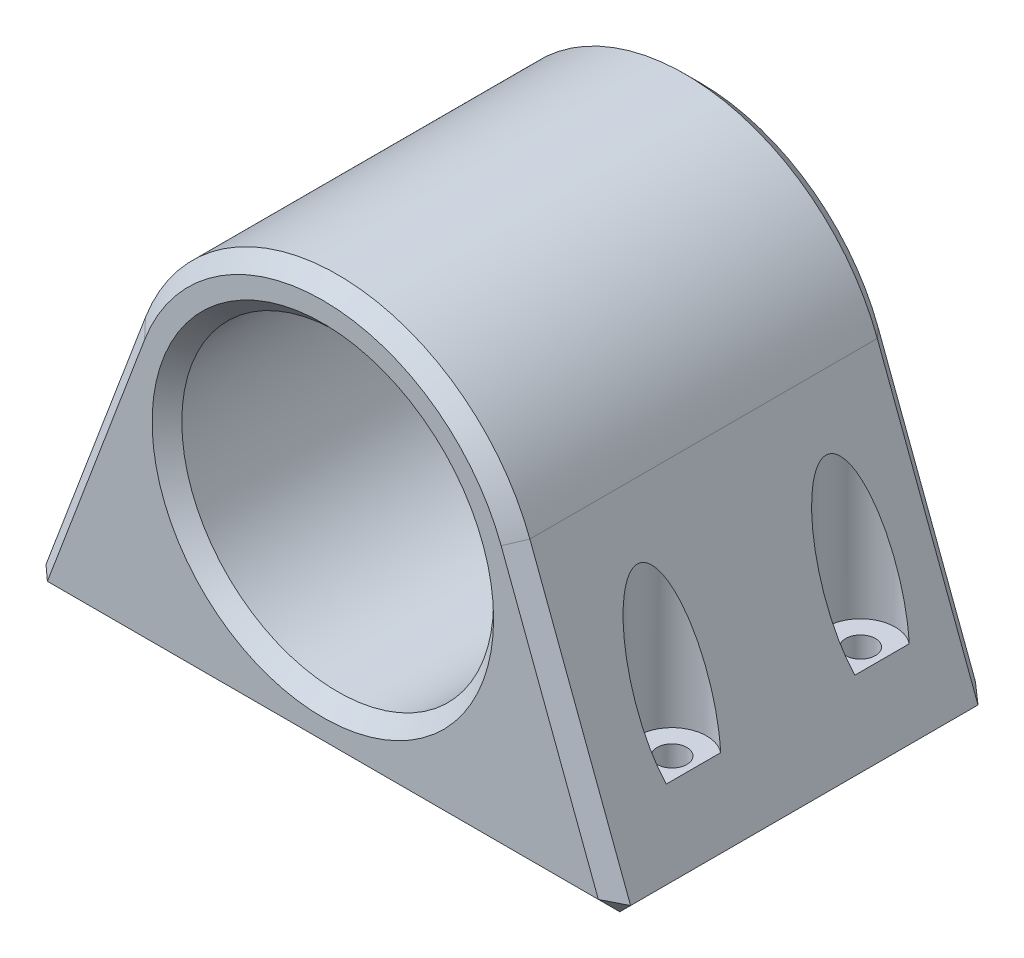
from build123d import *

# Parameters (mm, degrees)
SKETCH1_R           = 31.500002617
BOSS_EXTRUDE1_DEPTH = 76.2
SKETCH2_R           = 3
CUT_EXTRUDE1_DEPTH  = 335.545125332
SKETCH3_R           = 7
CUT_EXTRUDE2_DEPTH  = 332.142628978


with BuildPart() as part:
    # Sketch1 → Boss-Extrude1 (new body)
    with BuildSketch(Plane.XY):
        with BuildLine():
            Line((254.999981536, -0.500000028), (315.000000023, -0.500000028))
            Line((315.000000023, -0.500000028), (293.831301967, 55.641681824))
            ThreePointArc((293.831301967, 55.641681824), (254.99996624, 82.500005207), (216.168650312, 55.6416532))
            Line((216.168650312, 55.6416532), (195.000010316, -0.500000028))
            Line((195.000010316, -0.500000028), (254.999981536, -0.500000028))
        make_face()
        with Locations(Location((254.999981536, 41.00000259, 0), (0, 0, 180))):
            Circle(SKETCH1_R, mode=Mode.SUBTRACT)
    extrude(amount=BOSS_EXTRUDE1_DEPTH)

    # Sketch2 → Cut-Extrude1 (cut, through all)
    with BuildSketch(Plane.XZ.offset(0.500000028)):
        with Locations((205.000010316, 55.65)):
            Circle(SKETCH2_R)
        with Locations((205.000010316, 17.55)):
            Circle(SKETCH2_R)
        with Locations((305.000000023, 17.55)):
            Circle(SKETCH2_R)
        with Locations((305.000000023, 55.65)):
            Circle(SKETCH2_R)
    extrude(amount=-CUT_EXTRUDE1_DEPTH, mode=Mode.SUBTRACT)

    # Sketch3 → Cut-Extrude2 (cut, through all)
    with BuildSketch(Plane(origin=(0, 14.499999972, 0), x_dir=(-1, 0, 0), z_dir=(0, -1, 0))):
        with Locations((-205.000010316, -55.65)):
            Circle(SKETCH3_R)
        with Locations((-205.000010316, -17.55)):
            Circle(SKETCH3_R)
        with Locations((-305.000000023, -17.55)):
            Circle(SKETCH3_R)
        with Locations((-305.000000023, -55.65)):
            Circle(SKETCH3_R)
    extrude(amount=-CUT_EXTRUDE2_DEPTH, mode=Mode.SUBTRACT)

    # Chamfer1
    # the kernel refuses this chamfer: 3, 2.32827876, 2.328277984 mm, written as the material it takes off along each edge
    with BuildSketch(Plane(origin=(312.2804021, 1.226185537, 2), x_dir=(0.7489750456743214, -0.1749877092594348, 0.6390740822199596), z_dir=(0.49445065392204135, -0.49445065392203297, -0.7148685904920845))) as chamfer1_piece_1:
        Polygon((-2.712706316, -0.938589866), (1.981585134, -0.938589866), (0.731121181, 1.877179732), align=None)
    extrude(amount=3.990753507, mode=Mode.SUBTRACT)
    with BuildSketch(Plane(origin=(312.2804021, 1.226185537, 74.2), x_dir=(0.7489750456743212, -0.17498770925943466, -0.6390740822199599), z_dir=(0.49445065392204157, -0.4944506539220329, 0.7148685904920844))) as chamfer1_piece_2:
        Polygon((-2.712706316, 0.938589866), (1.981585134, 0.938589866), (0.731121181, -1.877179732), align=None)
    extrude(amount=3.990753507, mode=Mode.SUBTRACT)
    with BuildSketch(Plane(origin=(197.57469642, 1.435694642, 2), x_dir=(-0.7370953833685595, -0.043367244138400055, 0.6743957873182457), z_dir=(-0.6371026460751021, -0.2882074086415896, -0.7148683151239834))) as chamfer1_piece_3:
        Polygon((-2.694196805, 0.990466053), (1.754229559, 0.990466053), (0.939967246, -1.980932106), align=None)
    extrude(amount=3.990753255, mode=Mode.SUBTRACT)
    with BuildSketch(Plane(origin=(197.57469642, 1.435694642, 74.2), x_dir=(0.4121611112794653, -0.9111109802591978, 0), z_dir=(-0.637102646075102, -0.2882074086415896, 0.7148683151239834))) as chamfer1_piece_4:
        Polygon((-1.418873162, -1.430085067), (1.662073143, -1.430085067), (-0.243199981, 2.860170134), align=None)
    extrude(amount=3.990753255, mode=Mode.SUBTRACT)
    with BuildSketch(Plane(origin=(315.000000023, -0.500000028, -7.715048964), x_dir=(-0.9996219169112968, -0.027495876610586858, 0), z_dir=(0, 0, 1))) as chamfer1_piece_5:
        with BuildLine():
            Line((3.086019586, 0), (0.674077573, -2.282806951))
            Line((0.674077573, -2.282806951), (0.617375083, -2.302423975))
            ThreePointArc((0.617375083, -2.302423975), (0.331998575, -1.143147207), (-0.05670249, -0.019617024))
            Line((-0.05670249, -0.019617024), (0.001649753, 0.059977315))
            ThreePointArc((0.001649753, 0.059977315), (1.543492994, 0.017566949), (3.087669338, 0.059977315))
            Line((3.087669338, 0.059977315), (3.086019586, 0))
        make_face()
    extrude(amount=91.630097928, mode=Mode.SUBTRACT)
    with BuildSketch(Plane(origin=(195.000010316, -0.500000028, -7.715048964), x_dir=(0.9989444981358719, -0.04593353507048098, 0), z_dir=(0, 0, 1))) as chamfer1_piece_6:
        with BuildLine():
            Line((2.380250452, 0), (0.873946844, 2.959684746))
            Line((0.873946844, 2.959684746), (0.81689207, 2.978252267))
            ThreePointArc((0.81689207, 2.978252267), (0.420262466, 1.485280674), (-0.057054773, 0.018567521))
            Line((-0.057054773, 0.018567521), (0.002756012, -0.05993667))
            ThreePointArc((0.002756012, -0.05993667), (1.190370205, -0.005327712), (2.383006464, -0.05993667))
            Line((2.383006464, -0.05993667), (2.380250452, 0))
        make_face()
    extrude(amount=91.630097928, mode=Mode.SUBTRACT)
    with BuildSketch(Plane(origin=(317.721958218, -7.71892821, 76.2), x_dir=(-0.9353406389810182, -0.3526781334871724, 0.027495876610586882), z_dir=(-0.3528115255584857, 0.9356944092133361, 0))) as chamfer1_piece_7:
        with BuildLine():
            Line((3.086019586, 0), (-0.169641465, -3.081353381))
            Line((-0.169641465, -3.081353381), (-0.22961878, -3.079703628))
            ThreePointArc((-0.22961878, -3.079703628), (-0.102387681, -1.540193489), (-0.059977315, 0.001649753))
            Line((-0.059977315, 0.001649753), (0.001649753, 0.059977315))
            ThreePointArc((0.001649753, 0.059977315), (1.543492994, 0.017566949), (3.087669338, 0.059977315))
            Line((3.087669338, 0.059977315), (3.086019586, 0))
        make_face()
    extrude(amount=67.715067451, mode=Mode.SUBTRACT)
    with BuildSketch(Plane(origin=(254.999981536, 41.00000259, 76.2), x_dir=(0.9356944092133357, 0.3528115255584864, 0), z_dir=(0.3528115255584864, -0.9356944092133357, 0))) as chamfer1_piece_8:
        with BuildLine():
            Line((41.584855431, -3.084852814), (38.415149803, 0.084852814))
            Line((38.415149803, 0.084852814), (38.415149803, 0.144852814))
            ThreePointArc((38.415149803, 0.144852814), (39.95757621, 0.06), (41.500002617, 0.06))
            Line((41.500002617, 0.06), (41.560002617, 0))
            ThreePointArc((41.560002617, 0), (41.560002617, -1.542426407), (41.644855431, -3.084852814))
            Line((41.644855431, -3.084852814), (41.584855431, -3.084852814))
        make_face()
    revolve(axis=Axis((254.999981536, 41.00000259, 76.2), (0, 0, 1)), revolution_arc=138.681287603, mode=Mode.SUBTRACT)
    with BuildSketch(Plane(origin=(216.168650312, 55.6416532, 76.2), x_dir=(0.9353408989512485, -0.3526774440171723, 0.027495876610586775), z_dir=(-0.35281083582771006, -0.9356946692818939, 0))) as chamfer1_piece_9:
        with BuildLine():
            Line((3.086019586, 0), (-0.169641465, -3.081353381))
            Line((-0.169641465, -3.081353381), (-0.22961878, -3.079703628))
            ThreePointArc((-0.22961878, -3.079703628), (-0.102387681, -1.540193489), (-0.059977315, 0.001649753))
            Line((-0.059977315, 0.001649753), (0.001649753, 0.059977315))
            ThreePointArc((0.001649753, 0.059977315), (1.543492994, 0.017566949), (3.087669338, 0.059977315))
            Line((3.087669338, 0.059977315), (3.086019586, 0))
        make_face()
    extrude(amount=67.715020184, mode=Mode.SUBTRACT)
    with BuildSketch(Plane(origin=(305.000000023, -0.500000028, 55.65), x_dir=(1, 0, 0), z_dir=(0, 0, -1))) as chamfer1_piece_10:
        with BuildLine():
            Line((6.084852814, 0.084852814), (2.915147186, -3.084852814))
            Line((2.915147186, -3.084852814), (2.855147186, -3.084852814))
            ThreePointArc((2.855147186, -3.084852814), (2.94, -1.542426407), (2.94, 0))
            Line((2.94, 0), (3, 0.06))
            ThreePointArc((3, 0.06), (4.542426407, 0.06), (6.084852814, 0.144852814))
            Line((6.084852814, 0.144852814), (6.084852814, 0.084852814))
        make_face()
    revolve(axis=Axis((305.000000023, -0.500000028, 55.65), (0, -1, 0)), mode=Mode.SUBTRACT)
    with BuildSketch(Plane(origin=(305.000000023, -0.500000028, 17.55), x_dir=(1, 0, 0), z_dir=(0, 0, -1))) as chamfer1_piece_11:
        with BuildLine():
            Line((6.084852814, 0.084852814), (2.915147186, -3.084852814))
            Line((2.915147186, -3.084852814), (2.855147186, -3.084852814))
            ThreePointArc((2.855147186, -3.084852814), (2.94, -1.542426407), (2.94, 0))
            Line((2.94, 0), (3, 0.06))
            ThreePointArc((3, 0.06), (4.542426407, 0.06), (6.084852814, 0.144852814))
            Line((6.084852814, 0.144852814), (6.084852814, 0.084852814))
        make_face()
    revolve(axis=Axis((305.000000023, -0.500000028, 17.55), (0, -1, 0)), mode=Mode.SUBTRACT)
    with BuildSketch(Plane(origin=(322.715048987, -0.500000028, 76.2), x_dir=(0, 0.9996219169112968, 0.027495876610586778), z_dir=(-1, 0, 0))) as chamfer1_piece_12:
        with BuildLine():
            Line((3.086019586, 0), (-0.169641465, 3.081353381))
            Line((-0.169641465, 3.081353381), (-0.22961878, 3.079703628))
            ThreePointArc((-0.22961878, 3.079703628), (-0.102387681, 1.540193489), (-0.059977315, -0.001649753))
            Line((-0.059977315, -0.001649753), (0.001649753, -0.059977315))
            ThreePointArc((0.001649753, -0.059977315), (1.543492994, -0.017566949), (3.087669338, -0.059977315))
            Line((3.087669338, -0.059977315), (3.086019586, 0))
        make_face()
    extrude(amount=135.430087635, mode=Mode.SUBTRACT)
    with BuildSketch(Plane(origin=(205.000010316, -0.500000028, 17.55), x_dir=(1, 0, 0), z_dir=(0, 0, -1))) as chamfer1_piece_13:
        with BuildLine():
            Line((6.084852814, 0.084852814), (2.915147186, -3.084852814))
            Line((2.915147186, -3.084852814), (2.855147186, -3.084852814))
            ThreePointArc((2.855147186, -3.084852814), (2.94, -1.542426407), (2.94, 0))
            Line((2.94, 0), (3, 0.06))
            ThreePointArc((3, 0.06), (4.542426407, 0.06), (6.084852814, 0.144852814))
            Line((6.084852814, 0.144852814), (6.084852814, 0.084852814))
        make_face()
    revolve(axis=Axis((205.000010316, -0.500000028, 17.55), (0, -1, 0)), mode=Mode.SUBTRACT)
    with BuildSketch(Plane(origin=(205.000010316, -0.500000028, 55.65), x_dir=(1, 0, 0), z_dir=(0, 0, -1))) as chamfer1_piece_14:
        with BuildLine():
            Line((6.084852814, 0.084852814), (2.915147186, -3.084852814))
            Line((2.915147186, -3.084852814), (2.855147186, -3.084852814))
            ThreePointArc((2.855147186, -3.084852814), (2.94, -1.542426407), (2.94, 0))
            Line((2.94, 0), (3, 0.06))
            ThreePointArc((3, 0.06), (4.542426407, 0.06), (6.084852814, 0.144852814))
            Line((6.084852814, 0.144852814), (6.084852814, 0.084852814))
        make_face()
    revolve(axis=Axis((205.000010316, -0.500000028, 55.65), (0, -1, 0)), mode=Mode.SUBTRACT)
    with BuildSketch(Plane(origin=(254.999981536, 41.00000259, 76.2), x_dir=(-1, 0, 0), z_dir=(0, 1, 0))) as chamfer1_piece_15:
        with BuildLine():
            Line((34.584855431, 0.084852814), (31.415149803, -3.084852814))
            Line((31.415149803, -3.084852814), (31.355149803, -3.084852814))
            ThreePointArc((31.355149803, -3.084852814), (31.440002617, -1.542426407), (31.440002617, 0))
            Line((31.440002617, 0), (31.500002617, 0.06))
            ThreePointArc((31.500002617, 0.06), (33.042429024, 0.06), (34.584855431, 0.144852814))
            Line((34.584855431, 0.144852814), (34.584855431, 0.084852814))
        make_face()
    revolve(axis=Axis((254.999981536, 41.00000259, 76.2), (0, 0, 1)), mode=Mode.SUBTRACT)
    with BuildSketch(Plane(origin=(187.284961352, -0.500000028, 0), x_dir=(0, -0.027495876610586382, 0.9996219169112968), z_dir=(1, 0, 0))) as chamfer1_piece_16:
        with BuildLine():
            Line((3.086019586, 0), (-0.169641465, -3.081353381))
            Line((-0.169641465, -3.081353381), (-0.22961878, -3.079703628))
            ThreePointArc((-0.22961878, -3.079703628), (-0.102387681, -1.540193489), (-0.059977315, 0.001649753))
            Line((-0.059977315, 0.001649753), (0.001649753, 0.059977315))
            ThreePointArc((0.001649753, 0.059977315), (1.543492994, 0.017566949), (3.087669338, 0.059977315))
            Line((3.087669338, 0.059977315), (3.086019586, 0))
        make_face()
    extrude(amount=135.430087635, mode=Mode.SUBTRACT)
    with BuildSketch(Plane(origin=(216.168650312, 55.6416532, 0), x_dir=(0.9353408989512486, -0.3526774440171724, -0.027495876610586396), z_dir=(-0.35281083582771006, -0.9356946692818939, 0))) as chamfer1_piece_17:
        with BuildLine():
            Line((3.086019586, 0), (-0.169641465, 3.081353381))
            Line((-0.169641465, 3.081353381), (-0.22961878, 3.079703628))
            ThreePointArc((-0.22961878, 3.079703628), (-0.102387681, 1.540193489), (-0.059977315, -0.001649753))
            Line((-0.059977315, -0.001649753), (0.001649753, -0.059977315))
            ThreePointArc((0.001649753, -0.059977315), (1.543492994, -0.017566949), (3.087669338, -0.059977315))
            Line((3.087669338, -0.059977315), (3.086019586, 0))
        make_face()
    extrude(amount=67.715020184, mode=Mode.SUBTRACT)
    with BuildSketch(Plane(origin=(254.999981536, 41.00000259, 0), x_dir=(0.9356944092133357, 0.3528115255584864, 0), z_dir=(0.3528115255584864, -0.9356944092133357, 0))) as chamfer1_piece_18:
        with BuildLine():
            Line((41.584855431, 3.084852814), (38.415149803, -0.084852814))
            Line((38.415149803, -0.084852814), (38.415149803, -0.144852814))
            ThreePointArc((38.415149803, -0.144852814), (39.95757621, -0.06), (41.500002617, -0.06))
            Line((41.500002617, -0.06), (41.560002617, 0))
            ThreePointArc((41.560002617, 0), (41.560002617, 1.542426407), (41.644855431, 3.084852814))
            Line((41.644855431, 3.084852814), (41.584855431, 3.084852814))
        make_face()
    revolve(axis=Axis((254.999981536, 41.00000259, 0), (0, 0, 1)), revolution_arc=138.681287603, mode=Mode.SUBTRACT)
    with BuildSketch(Plane(origin=(317.721958218, -7.71892821, 0), x_dir=(-0.9353406389810183, -0.3526781334871725, -0.02749587661058642), z_dir=(-0.3528115255584857, 0.9356944092133361, 0))) as chamfer1_piece_19:
        with BuildLine():
            Line((3.086019586, 0), (-0.169641465, 3.081353381))
            Line((-0.169641465, 3.081353381), (-0.22961878, 3.079703628))
            ThreePointArc((-0.22961878, 3.079703628), (-0.102387681, 1.540193489), (-0.059977315, -0.001649753))
            Line((-0.059977315, -0.001649753), (0.001649753, -0.059977315))
            ThreePointArc((0.001649753, -0.059977315), (1.543492994, -0.017566949), (3.087669338, -0.059977315))
            Line((3.087669338, -0.059977315), (3.086019586, 0))
        make_face()
    extrude(amount=67.715067451, mode=Mode.SUBTRACT)
    with BuildSketch(Plane(origin=(254.999981536, 41.00000259, 0), x_dir=(-1, 0, 0), z_dir=(0, 1, 0))) as chamfer1_piece_20:
        with BuildLine():
            Line((31.415149803, 3.084852814), (34.584855431, -0.084852814))
            Line((34.584855431, -0.084852814), (34.584855431, -0.144852814))
            ThreePointArc((34.584855431, -0.144852814), (33.042429024, -0.06), (31.500002617, -0.06))
            Line((31.500002617, -0.06), (31.440002617, 0))
            ThreePointArc((31.440002617, 0), (31.440002617, 1.542426407), (31.355149803, 3.084852814))
            Line((31.355149803, 3.084852814), (31.415149803, 3.084852814))
        make_face()
    revolve(axis=Axis((254.999981536, 41.00000259, 0), (0, 0, 1)), mode=Mode.SUBTRACT)


solid = part.part
